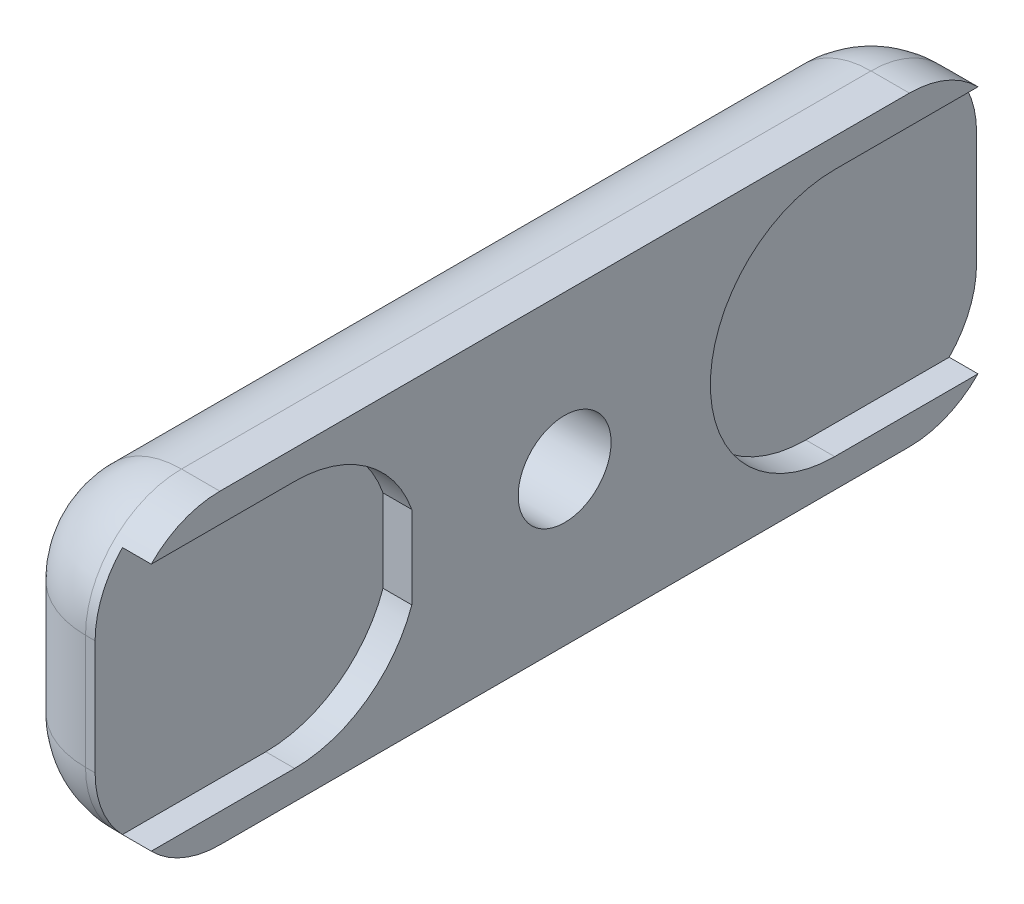
from build123d import *

# Parameters (mm, degrees)
BOSS_EXTRUDE3_DEPTH = 14
SKETCH3_R           = 4.84
CUT_EXTRUDE3_DEPTH  = 14.0462
CUT_EXTRUDE4_DEPTH  = 3
SKETCH6_W           = 32.77755098
SKETCH6_H           = 97.199429117
CUT_EXTRUDE6_DEPTH  = 68.951679292
FILLET1_R           = 10
FILLET2_R           = 10
FILLET3_R           = 10
FILLET4_R           = 10


with BuildPart() as part:
    # Sketch1 → Boss-Extrude3 (new body)
    with BuildSketch(Plane.YZ):
        with BuildLine():
            Line((-28.968617751, -12.789334175), (28.968617751, -12.789334175))
            ThreePointArc((28.968617751, -12.789334175), (44.579120821, 0), (35.110840206, 17.821518929))
            ThreePointArc((35.110840206, 17.821518929), (30.644623053, 21.505675602), (28.968617751, 27.047436358))
            Line((28.968617751, 27.047436358), (28.968617751, 39.053986921))
            ThreePointArc((28.968617751, 39.053986921), (26.039685563, 46.125054733), (18.968617751, 49.053986921))
            Line((18.968617751, 49.053986921), (-18.968617751, 49.053986921))
            ThreePointArc((-18.968617751, 49.053986921), (-26.039685563, 46.125054733), (-28.968617751, 39.053986921))
            Line((-28.968617751, 39.053986921), (-28.968617751, 27.047436358))
            ThreePointArc((-28.968617751, 27.047436358), (-30.644623053, 21.505675602), (-35.110840206, 17.821518929))
            ThreePointArc((-35.110840206, 17.821518929), (-44.579120821, 0), (-28.968617751, -12.789334175))
        make_face()
    boss_extrude3 = extrude(amount=BOSS_EXTRUDE3_DEPTH)

    # Sketch3 → Cut-Extrude3 (cut)
    with BuildSketch(Plane.YZ.offset(14)):
        with Locations((0, 3.132326373)):
            Circle(SKETCH3_R)
    cut_extrude3 = extrude(amount=-CUT_EXTRUDE3_DEPTH, mode=Mode.SUBTRACT)

    # Sketch4 → Cut-Extrude4 (cut)
    with BuildSketch(Plane.YZ.offset(14)):
        with BuildLine():
            Line((-12.95, 49.053986921), (-12.95, 31.267703884))
            ThreePointArc((-12.95, 31.267703884), (0, 18.317703884), (12.95, 31.267703884))
            Line((12.95, 31.267703884), (12.95, 49.053986921))
            Line((12.95, 49.053986921), (-12.95, 49.053986921))
        make_face()
    cut_extrude4 = extrude(amount=-CUT_EXTRUDE4_DEPTH, mode=Mode.SUBTRACT)

    # Mirror1: Boss-Extrude3, Cut-Extrude3, Cut-Extrude4 across plane
    add(boss_extrude3.mirror(Plane.XY.offset(3.132326373)))
    add(cut_extrude3.mirror(Plane.XY.offset(3.132326373)), mode=Mode.SUBTRACT)
    add(cut_extrude4.mirror(Plane.XY.offset(3.132326373)), mode=Mode.SUBTRACT)

    # Sketch6 → Cut-Extrude6 (cut, through all)
    with BuildSketch(Plane.YZ.offset(14)):
        with Locations((-32.348084365, 0.454272362)):
            Rectangle(SKETCH6_W, SKETCH6_H)
        with Locations((32.348084365, 0.454272362)):
            Rectangle(SKETCH6_W, SKETCH6_H)
    extrude(amount=-CUT_EXTRUDE6_DEPTH, mode=Mode.SUBTRACT)

    # Fillet1
    fillet1_edges = [part.edges().sort_by_distance(p)[0] for p in [
        (0, -15.959308875, 3.132326373),
    ]]
    fillet(fillet1_edges, radius=FILLET1_R)

    # Fillet2
    fillet2_edges = [part.edges().sort_by_distance(p)[0] for p in [
        (0, 5, -42.789334175),
        (2.928932188, -13.030376687, -42.789334175),
        (12, -15.959308875, -42.789334175),
    ]]
    fillet(fillet2_edges, radius=FILLET2_R)

    # Fillet3
    fillet3_edges = [part.edges().sort_by_distance(p)[0] for p in [
        (0, 5, 49.053986921),
        (2.928932188, -13.030376687, 49.053986921),
        (12, -15.959308875, 49.053986921),
    ]]
    fillet(fillet3_edges, radius=FILLET3_R)

    # Fillet4
    fillet4_edges = [part.edges().sort_by_distance(p)[0] for p in [
        (12, 15.959308875, -42.789334175),
        (2.928932188, 15.959308875, -39.860401987),
        (0, 15.959308875, 3.132326373),
        (2.928932188, 15.959308875, 46.125054733),
        (12, 15.959308875, 49.053986921),
    ]]
    fillet(fillet4_edges, radius=FILLET4_R)


solid = part.part
